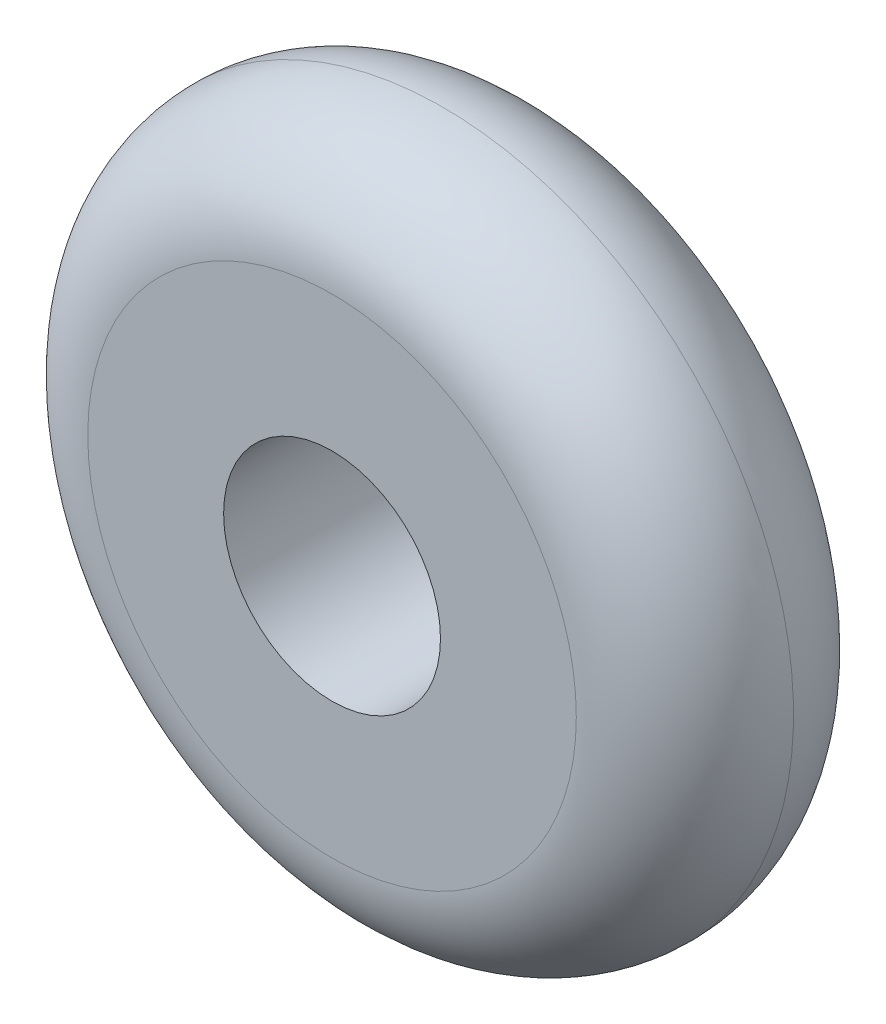
from build123d import *
from OCP.BRepAlgoAPI import BRepAlgoAPI_Cut
from OCP.TopTools import TopTools_ListOfShape

# Parameters (mm, degrees)
SKETCH1_R           = 34.75
SKETCH1_R_2         = 10.75
BOSS_EXTRUDE1_DEPTH = 22


with BuildPart() as part:
    # Sketch1 → Boss-Extrude1 (new body)
    with BuildSketch(Plane.XY):
        Circle(SKETCH1_R)
        Circle(SKETCH1_R_2, mode=Mode.SUBTRACT)
    extrude(amount=BOSS_EXTRUDE1_DEPTH)


with BuildPart() as cut_revolve1_tool:
    # Sketch2 → Cut-Revolve1 (revolve)
    with BuildSketch(Plane(origin=(0, 0, 0), x_dir=(1, 0, 0), z_dir=(0, 1, 0))):
        with BuildLine():
            add(Edge.make_bspline(
                [(34.750000979, -11), (34.750000979, -16.928934181), (29.898383741, -21.971044208), (24.216404338, -22)],
                knots=[0, 0, 0, 0, 0.994266227, 0.994266227, 0.994266227, 0.994266227], degree=3))
            Line((24.216404338, -22), (34.75, -22))
            Line((34.75, -22), (34.750000979, -11))
        make_face()
        with BuildLine():
            add(Edge.make_bspline(
                [(34.750000979, -11), (34.750000979, -5.071065819), (29.898383741, -0.028955792), (24.216404338, 0)],
                knots=[0, 0, 0, 0, 0.994266227, 0.994266227, 0.994266227, 0.994266227], degree=3))
            Line((34.750000979, -11), (37, 0))
            Line((37, 0), (24.216404338, 0))
        make_face()
    revolve(axis=Axis((0, 0, 0), (0, 0, 1)))


with BuildPart() as part_1:
    add(part.part)

    # Cut-Revolve1: cut by cut_revolve1_tool, with a tolerance
    cut_revolve1_stock = TopTools_ListOfShape()
    cut_revolve1_stock.Append(part_1.part.wrapped)
    cut_revolve1_tools = TopTools_ListOfShape()
    cut_revolve1_tools.Append(cut_revolve1_tool.part.wrapped)
    cut_revolve1_cut = BRepAlgoAPI_Cut()
    cut_revolve1_cut.SetArguments(cut_revolve1_stock)
    cut_revolve1_cut.SetTools(cut_revolve1_tools)
    cut_revolve1_cut.SetFuzzyValue(0.00001)
    cut_revolve1_cut.Build()
    add(Compound.cast(cut_revolve1_cut.Shape()).solids(), mode=Mode.REPLACE)


solid = part_1.part
